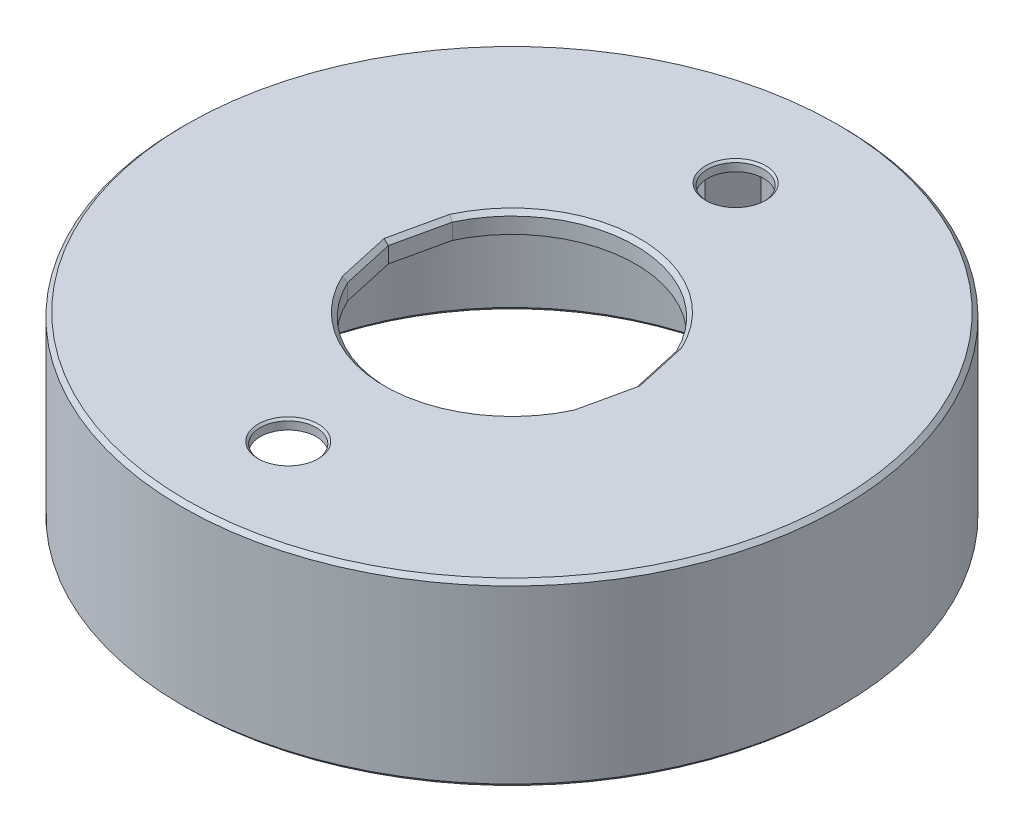
from build123d import *

# Parameters (mm, degrees)
SKETCH1_R           = 16.5
SKETCH1_R_2         = 12.73
BOSS_EXTRUDE1_DEPTH = 8
SKETCH2_R           = 16.5
BOSS_EXTRUDE2_DEPTH = 1
SKETCH3_R           = 1.4025
CUT_EXTRUDE1_DEPTH  = 12
CUT_EXTRUDE2_DEPTH  = 12
CUT_EXTRUDE3_DEPTH  = 0.5
CUT_EXTRUDE4_DEPTH  = 17.5
CUT_EXTRUDE5_DEPTH  = 0.5
SCALE1_SCALE        = 1.212121212
CHAMFER1_SIZE       = 0.25
CHAMFER2_SIZE       = 0.125
CHAMFER3_SIZE       = 0.25
CHAMFER4_SIZE       = 0.25


with BuildPart() as part:
    # Sketch1 → Boss-Extrude1 (new body)
    with BuildSketch(Plane(origin=(0, 0, 0), x_dir=(1, 0, 0), z_dir=(0, 1, 0))):
        Circle(SKETCH1_R)
        Circle(SKETCH1_R_2, mode=Mode.SUBTRACT)
    extrude(amount=BOSS_EXTRUDE1_DEPTH)

    # Sketch2 → Boss-Extrude2 (add)
    with BuildSketch(Plane(origin=(0, 8, 0), x_dir=(1, 0, 0), z_dir=(0, 1, 0))):
        Circle(SKETCH2_R)
    extrude(amount=BOSS_EXTRUDE2_DEPTH)

    # Sketch3 → Cut-Extrude1 (cut)
    with BuildSketch(Plane(origin=(0, 9, 0), x_dir=(1, 0, 0), z_dir=(0, 1, 0))):
        with Locations((0, 11.2)):
            Circle(SKETCH3_R)
        with BuildLine():
            ThreePointArc((5.605680559, 2.619446836), (0, 6.1875), (-5.605680559, 2.619446836))
            Line((-5.605680559, 2.619446836), (-6.1875, 0))
            Line((-6.1875, 0), (-5.605680559, -2.619446836))
            ThreePointArc((-5.605680559, -2.619446836), (0, -6.1875), (5.605680559, -2.619446836))
            Line((5.605680559, -2.619446836), (6.1875, 0))
            Line((6.1875, 0), (5.605680559, 2.619446836))
        make_face()
        with Locations((0, -11.2)):
            Circle(SKETCH3_R)
    extrude(amount=-CUT_EXTRUDE1_DEPTH, mode=Mode.SUBTRACT)

    # Sketch4 → Cut-Extrude2 (cut)
    with BuildSketch(Plane.XZ.offset(-8)):
        Polygon((3.464101615, 11.2), (1.732050808, 14.2), (-1.732050808, 14.2), (-3.464101615, 11.2), (-1.732050808, 8.2), (1.732050808, 8.2), align=None)
    extrude(amount=CUT_EXTRUDE2_DEPTH, mode=Mode.SUBTRACT)

    # Sketch5 → Cut-Extrude3 (cut)
    with BuildSketch(Plane.XZ.offset(-8)):
        Polygon((3.441649055, 11.2), (1.720824528, 14.180555513), (-1.720824528, 14.180555513), (-3.441649055, 11.2), (-1.720824528, 8.219444487), (1.720824528, 8.219444487), align=None)
    extrude(amount=-CUT_EXTRUDE3_DEPTH, mode=Mode.SUBTRACT)

    # Sketch6 → Cut-Extrude4 (cut)
    with BuildSketch(Plane.XZ.offset(-8)):
        Polygon((3.464101615, -11.2), (1.732050808, -8.2), (-1.732050808, -8.2), (-3.464101615, -11.2), (-1.732050808, -14.2), (1.732050808, -14.2), align=None)
    extrude(amount=CUT_EXTRUDE4_DEPTH, mode=Mode.SUBTRACT)

    # Sketch7 → Cut-Extrude5 (cut)
    with BuildSketch(Plane.XZ.offset(-8)):
        Polygon((3.487584053, -11.2), (1.743792026, -8.179663613), (-1.743792026, -8.179663613), (-3.487584053, -11.2), (-1.743792026, -14.220336387), (1.743792026, -14.220336387), align=None)
    extrude(amount=-CUT_EXTRUDE5_DEPTH, mode=Mode.SUBTRACT)


with BuildPart() as part_1:
    # Scale1: scaled about (0, 4.937956198, 0.001378728)
    add(part.part.scale(SCALE1_SCALE).moved(Location((0, -1.047445254, -0.000292457))))

    # Chamfer1
    chamfer1_edges = [part_1.edges().sort_by_distance(p)[0] for p in [
        (-7.147382157, 9.861645655, 1.587251079),
        (-7.147382157, 9.861645655, -1.587835994),
        (0, 9.861645655, -7.500292457),
        (7.147382157, 9.861645655, -1.587835994),
        (7.147382157, 9.861645655, 1.587251079),
        (0, 9.861645655, 7.499707543),
        (-20, 9.861645655, -0.000292457),
    ]]
    chamfer(chamfer1_edges, length=CHAMFER1_SIZE)

    # Chamfer2
    chamfer2_edges = [part_1.edges().sort_by_distance(p)[0] for p in [
        (-1.7, 9.861645655, -13.576050033),
        (-1.7, 9.861645655, 13.575465118),
    ]]
    chamfer(chamfer2_edges, length=CHAMFER2_SIZE)

    # Chamfer3
    chamfer3_edges = [part_1.edges().sort_by_distance(p)[0] for p in [
        (2.719380836, -1.047445254, -16.138671532),
        (0, -1.047445254, -17.21241367),
        (-2.719380836, -1.047445254, -16.138671532),
        (-15.43030303, -1.047445254, -0.000292457),
        (-2.719380836, -1.047445254, 16.138086617),
        (0, -1.047445254, 17.211828755),
        (2.719380836, -1.047445254, 16.138086617),
        (15.43030303, -1.047445254, -0.000292457),
    ]]
    chamfer(chamfer3_edges, length=CHAMFER3_SIZE)

    # Chamfer4
    chamfer4_edges = [part_1.edges().sort_by_distance(p)[0] for p in [
        (-20, -1.047445254, -0.000292457),
    ]]
    chamfer(chamfer4_edges, length=CHAMFER4_SIZE)


solid = part_1.part
